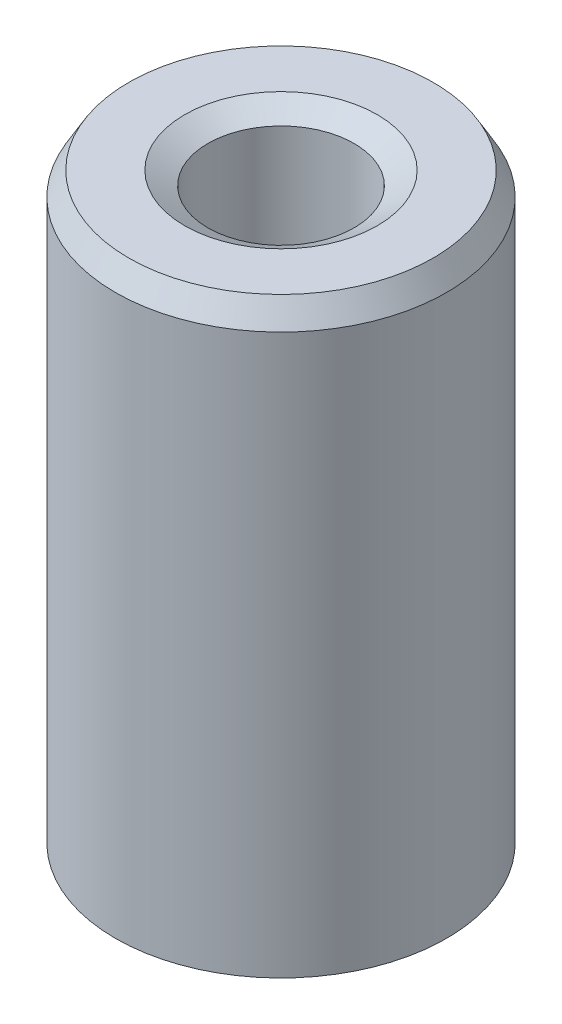
from build123d import *
from OCP.BRepFilletAPI import BRepFilletAPI_MakeChamfer

# Parameters (mm, degrees)
SKETCH1_R           = 22.5
BOSS_EXTRUDE1_DEPTH = 80.974810095
SKETCH2_R           = 9.937905238
CUT_EXTRUDE1_DEPTH  = 88.002413013
CHAMFER1_SIZE       = 3.147312376
CHAMFER1_SIZE2      = 1.817101648


with BuildPart() as part:
    # Sketch1 → Boss-Extrude1 (new body)
    with BuildSketch(Plane(origin=(0, 0, 0), x_dir=(1, 0, 0), z_dir=(0, 1, 0))):
        Circle(SKETCH1_R)
    extrude(amount=BOSS_EXTRUDE1_DEPTH)

    # Sketch2 → Cut-Extrude1 (cut, through all)
    with BuildSketch(Plane(origin=(0, 0, 0), x_dir=(1, 0, 0), z_dir=(0, 1, 0))):
        Circle(SKETCH2_R)
    extrude(amount=CUT_EXTRUDE1_DEPTH, mode=Mode.SUBTRACT)

    # Chamfer1: one chamfer whose edges measure the first distance from different faces: ONE call of the kernel's chamfer builder (chamfer() names one face for all edges)
    chamfer1_edges_1 = [part.edges().sort_by_distance(p)[0] for p in [
        (-9.937905238, 80.974810095, 0),
    ]]
    chamfer1_side_1 = [part.faces().sort_by_distance(p)[0] for p in [
        (-21.863603897, 80.974810095, 0),
    ]]
    chamfer1_edges_2 = [part.edges().sort_by_distance(p)[0] for p in [
        (-9.937905238, 0, 0),
    ]]
    chamfer1_side_2 = [part.faces().sort_by_distance(p)[0] for p in [
        (-9.937905238, 40.487405048, 0),
    ]]
    chamfer1_edges_3 = [part.edges().sort_by_distance(p)[0] for p in [
        (-22.5, 0, 0),
    ]]
    chamfer1_side_3 = [part.faces().sort_by_distance(p)[0] for p in [
        (-21.863603897, 0, 0),
    ]]
    chamfer1_edges_4 = [part.edges().sort_by_distance(p)[0] for p in [
        (-22.5, 80.974810095, 0),
    ]]
    chamfer1_side_4 = [part.faces().sort_by_distance(p)[0] for p in [
        (-22.5, 40.487405048, 0),
    ]]
    chamfer1 = BRepFilletAPI_MakeChamfer(part.part.solid().wrapped)
    for e in chamfer1_edges_1:
        chamfer1.Add(CHAMFER1_SIZE, CHAMFER1_SIZE2, e.wrapped, chamfer1_side_1[0].wrapped)  # the first distance lies on this face
    for e in chamfer1_edges_2:
        chamfer1.Add(CHAMFER1_SIZE, CHAMFER1_SIZE2, e.wrapped, chamfer1_side_2[0].wrapped)  # the first distance lies on this face
    for e in chamfer1_edges_3:
        chamfer1.Add(CHAMFER1_SIZE, CHAMFER1_SIZE2, e.wrapped, chamfer1_side_3[0].wrapped)  # the first distance lies on this face
    for e in chamfer1_edges_4:
        chamfer1.Add(CHAMFER1_SIZE, CHAMFER1_SIZE2, e.wrapped, chamfer1_side_4[0].wrapped)  # the first distance lies on this face
    add(Compound.cast(chamfer1.Shape()), mode=Mode.REPLACE)


solid = part.part
